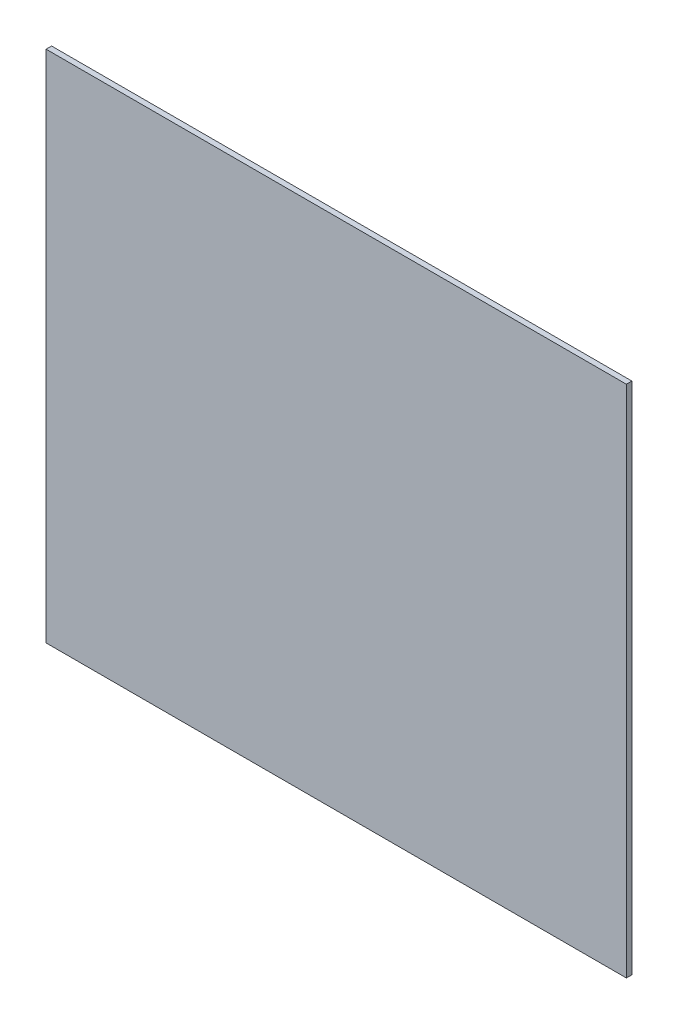
from build123d import *

# Parameters (mm, degrees)
SKETCH1_W           = 316
SKETCH1_H           = 280
BOSS_EXTRUDE1_DEPTH = 3


with BuildPart() as part:
    # Sketch1 → Boss-Extrude1 (new body)
    with BuildSketch(Plane.XY):
        Rectangle(SKETCH1_W, SKETCH1_H)
    extrude(amount=BOSS_EXTRUDE1_DEPTH)


solid = part.part
